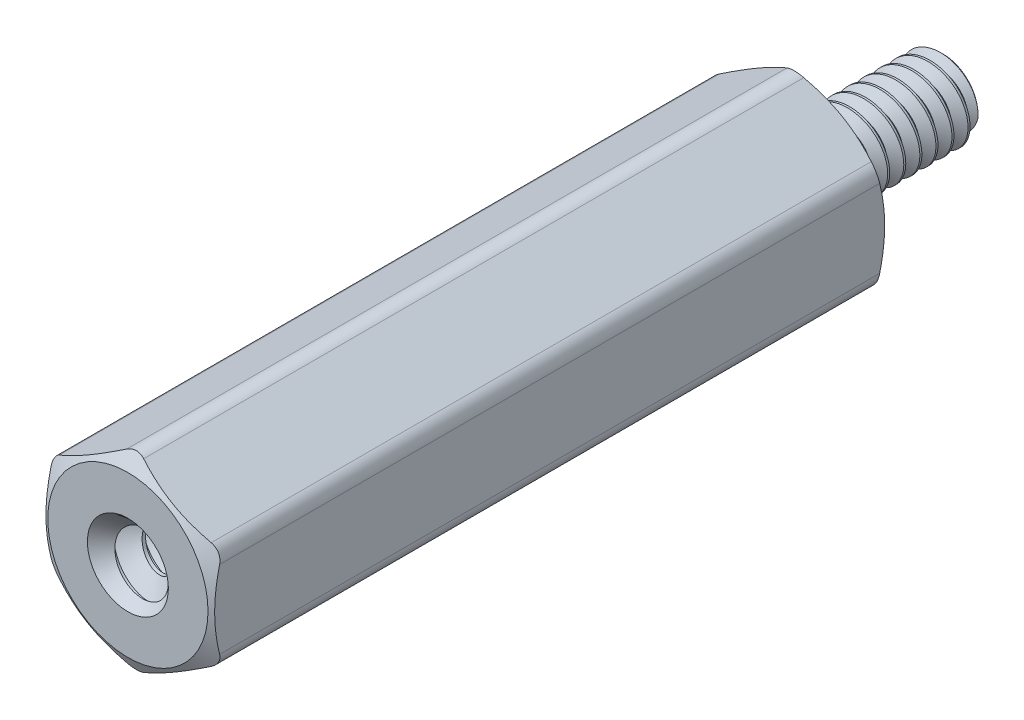
from build123d import *

# Parameters (mm, degrees)
SKETCH4_R           = 1.736725
BOSS_EXTRUDE1_DEPTH = 19.05
SKETCH5_OUTSIDE_W   = 95.784
SKETCH5_OUTSIDE_H   = 96.522
SKETCH5_OUTSIDE_R   = 2.2621875
CUT_EXTRUDE1_DEPTH  = 24.304370231
CUT_EXTRUDE1_DRAFT  = -60
SKETCH6_OUTSIDE_W   = 82.238
SKETCH6_OUTSIDE_H   = 82.976
SKETCH6_OUTSIDE_R   = 2.2621875
CUT_EXTRUDE2_DEPTH  = 20.39415686
CUT_EXTRUDE2_DRAFT  = -60
FILLET1_R           = 0.47625
CUT_SWEEP1_PITCH    = 0.453571429
SKETCH9_R           = 1.205592857
BOSS_EXTRUDE2_DEPTH = 4.7752
SKETCH10_W          = 4.7752
SKETCH10_H          = 1.0922
CUT_SWEEP2_PITCH    = 0.79375


with BuildPart() as part:
    # Sketch3 → Revolve1 (revolve)
    with BuildSketch(Plane(origin=(0, 0, 0), x_dir=(0, 0, -1), z_dir=(1, 0, 0))):
        with BuildLine():
            Line((-14.2748, 0.978807143), (-14.2748, 0))
            Line((-14.2748, 0), (3.96875, 0))
            Line((3.96875, 0), (3.96875, 0.978807143))
            Line((3.96875, 0.978807143), (3.855357143, 1.0922))
            Line((3.855357143, 1.0922), (0.646339286, 1.0922))
            Line((0.646339286, 1.0922), (0.47625, 0.797596715))
            Line((0.47625, 0.797596715), (0.113392857, 0.797596715))
            ThreePointArc((0.113392857, 0.797596715), (0.033211999, 0.830808714), (0, 0.910989572))
            Line((0, 0.910989572), (0, 2.38125))
            Line((0, 2.38125), (-19.05, 2.38125))
            Line((-19.05, 2.38125), (-19.05, 1.205592857))
            Line((-19.05, 1.205592857), (-18.936607143, 1.0922))
            Line((-18.936607143, 1.0922), (-14.388192857, 1.0922))
            Line((-14.388192857, 1.0922), (-14.2748, 0.978807143))
        make_face()
    revolve(axis=Axis((0, 0, -3.96875), (0, 0, 1)))

    # Sketch4 → Boss-Extrude1 (add)
    with BuildSketch(Plane.XY.offset(19.05)):
        Polygon((-2.38125, 1.374815329), (-2.38125, -1.374815329), (0, -2.749630657), (2.38125, -1.374815329), (2.38125, 1.374815329), (0, 2.749630657), align=None)
        Circle(SKETCH4_R, mode=Mode.SUBTRACT)
    extrude(amount=-BOSS_EXTRUDE1_DEPTH)


with BuildPart() as cut_extrude1_tool:
    # Sketch5 outside → Cut-Extrude1 (with draft: the straight prism first)
    with BuildSketch(Plane.XY.offset(19.05)):
        Rectangle(SKETCH5_OUTSIDE_W, SKETCH5_OUTSIDE_H)
        Circle(SKETCH5_OUTSIDE_R, mode=Mode.SUBTRACT)
    extrude(amount=-CUT_EXTRUDE1_DEPTH)
    # Cut-Extrude1: the draft: its side faces are tilted about the plane it starts from
    cut_extrude1_sides = [cut_extrude1_tool.faces().sort_by_distance(p)[0] for p in [
        (0, -48.261, 6.897814884),
        (47.892, 0, 6.897814884),
        (0, 48.261, 6.897814884),
        (-47.892, 0, 6.897814884),
        (-2.2621875, 0, 6.897814884),
    ]]
    draft(cut_extrude1_sides, Plane.XY.offset(19.05), CUT_EXTRUDE1_DRAFT)


with BuildPart() as part_1:
    add(part.part)

    # Cut-Extrude1: cut by cut_extrude1_tool
    add(cut_extrude1_tool.part, mode=Mode.SUBTRACT)


with BuildPart() as cut_extrude2_tool:
    # Sketch6 outside → Cut-Extrude2 (with draft: the straight prism first)
    with BuildSketch(Plane(origin=(0, 0, 0), x_dir=(-1, 0, 0), z_dir=(0, 0, -1))):
        Rectangle(SKETCH6_OUTSIDE_W, SKETCH6_OUTSIDE_H)
        Circle(SKETCH6_OUTSIDE_R, mode=Mode.SUBTRACT)
    extrude(amount=-CUT_EXTRUDE2_DEPTH)
    # Cut-Extrude2: the draft: its side faces are tilted about the plane it starts from
    cut_extrude2_sides = [cut_extrude2_tool.faces().sort_by_distance(p)[0] for p in [
        (0, -41.488, 10.19707843),
        (-41.119, 0, 10.19707843),
        (0, 41.488, 10.19707843),
        (41.119, 0, 10.19707843),
        (2.2621875, 0, 10.19707843),
    ]]
    draft(cut_extrude2_sides, Plane(origin=(0, 0, 0), x_dir=(-1, 0, 0), z_dir=(0, 0, -1)), CUT_EXTRUDE2_DRAFT)


with BuildPart() as part_2:
    add(part_1.part)

    # Cut-Extrude2: cut by cut_extrude2_tool
    add(cut_extrude2_tool.part, mode=Mode.SUBTRACT)

    # Fillet1
    fillet1_edges = [part_2.edges().sort_by_distance(p)[0] for p in [
        (0, 2.749630657, 9.525),
        (-2.38125, -1.374815329, 9.525),
        (0, -2.749630657, 9.525),
        (2.38125, -1.374815329, 9.525),
        (2.38125, 1.374815329, 9.525),
        (-2.38125, 1.374815329, 9.525),
    ]]
    fillet(fillet1_edges, radius=FILLET1_R)

    # Cut-Sweep1: the profile of Sketch7 profile screwed along a right-hand helix of 8.4875 turns, 6 arcs to a turn; built about Z, then put on its axis
    cut_sweep1_z = Axis((0, 0, 0), (0, 0, 1))
    cut_sweep1_corners = [(0.797296715, 0, -0.170262491), (0.797296715, 0, -0.226612509), (1.116750274, 0, -0.411049107), (1.116750274, 0, 0.014174107)]
    with BuildLine(mode=Mode.PRIVATE) as cut_sweep1_profile:
        Line(cut_sweep1_corners[0], cut_sweep1_corners[1])
        Line(cut_sweep1_corners[1], cut_sweep1_corners[2])
        Line(cut_sweep1_corners[2], cut_sweep1_corners[3])
        Line(cut_sweep1_corners[3], cut_sweep1_corners[0])
    cut_sweep1_cap = Face(cut_sweep1_profile.wire())
    cut_sweep1_turn_angles = [0, 30, 60, 90, 120, 150, 180, 210, 240, 270, 300, 330, 360]
    cut_sweep1_turn_weights = [1, 0.8660254037844387, 1, 0.8660254037844387, 1, 0.8660254037844387, 1, 0.8660254037844387, 1, 0.8660254037844387, 1, 0.8660254037844387, 1]
    cut_sweep1_turn_rails = [Edge.make_bspline([Vector(p[0], p[1], 0).rotate(cut_sweep1_z, cut_sweep1_turn_angles[k]) / cut_sweep1_turn_weights[k] + Vector(0, 0, p[2] + CUT_SWEEP1_PITCH * cut_sweep1_turn_angles[k] / 360) for k in range(13)], [0, 0, 0, 1, 1, 2, 2, 3, 3, 4, 4, 5, 5, 6, 6, 6], 2, cut_sweep1_turn_weights) for p in cut_sweep1_corners]
    cut_sweep1_turn_sides = [Face.make_surface_from_curves(cut_sweep1_turn_rails[p[0]], cut_sweep1_turn_rails[p[1]]) for p in [(0, 1), (1, 2), (2, 3), (3, 0)]]
    cut_sweep1_last_angles = [2880, 2910, 2940, 2970, 3000, 3027.75, 3055.5]
    cut_sweep1_last_weights = [1, 0.8660254037844387, 1, 0.8660254037844387, 1, 0.8849876374631195, 1]
    cut_sweep1_last_rails = [Edge.make_bspline([Vector(p[0], p[1], 0).rotate(cut_sweep1_z, cut_sweep1_last_angles[k]) / cut_sweep1_last_weights[k] + Vector(0, 0, p[2] + CUT_SWEEP1_PITCH * cut_sweep1_last_angles[k] / 360) for k in range(7)], [0, 0, 0, 1, 1, 2, 2, 3, 3, 3], 2, cut_sweep1_last_weights) for p in cut_sweep1_corners]
    cut_sweep1_last_sides = [Face.make_surface_from_curves(cut_sweep1_last_rails[p[0]], cut_sweep1_last_rails[p[1]]) for p in [(0, 1), (1, 2), (2, 3), (3, 0)]]
    cut_sweep1 = Plane(origin=(0, 0, -3.96875), x_dir=(0, 1, 0), z_dir=(0, 0, 1)) * Solid(Shell([*[p.moved(Location((0, 0, CUT_SWEEP1_PITCH * i))) for i in range(8) for p in cut_sweep1_turn_sides], *cut_sweep1_last_sides, cut_sweep1_cap, cut_sweep1_cap.rotate(cut_sweep1_z, 3055.5).moved(Location((0, 0, CUT_SWEEP1_PITCH * 3055.5 / 360)))]))
    add(cut_sweep1, mode=Mode.SUBTRACT)

    # Sketch9 → Boss-Extrude2 (add)
    with BuildSketch(Plane.XY.offset(14.2748)):
        Circle(SKETCH9_R)
    extrude(amount=BOSS_EXTRUDE2_DEPTH)


with BuildPart() as body_2:
    # Sketch10 → Revolve2 (revolve)
    with BuildSketch(Plane(origin=(0, 0, 0), x_dir=(0, 0, -1), z_dir=(1, 0, 0))):
        with Locations((-16.6624, 0.5461)):
            Rectangle(SKETCH10_W, SKETCH10_H)
    revolve(axis=Axis((0, 0, -3.96875), (0, 0, 1)))

    # Cut-Sweep2: the profile of Sketch12 screwed along a right-hand helix of 7.016 turns, 8 arcs to a turn; built about Z, then put on its axis
    cut_sweep2_z = Axis((0, 0, 0), (0, 0, 1))
    cut_sweep2_corners = [(0.576644252, 0, -0.396875), (0.576644252, 0, -0.29765625), (1.135162979, 0, 0.024804688), (1.135162979, 0, -0.719335937)]
    with BuildLine(mode=Mode.PRIVATE) as cut_sweep2_profile:
        Line(cut_sweep2_corners[0], cut_sweep2_corners[1])
        Line(cut_sweep2_corners[1], cut_sweep2_corners[2])
        Line(cut_sweep2_corners[2], cut_sweep2_corners[3])
        Line(cut_sweep2_corners[3], cut_sweep2_corners[0])
    cut_sweep2_cap = Face(cut_sweep2_profile.wire())
    cut_sweep2_turn_angles = [0, 22.5, 45, 67.5, 90, 112.5, 135, 157.5, 180, 202.5, 225, 247.5, 270, 292.5, 315, 337.5, 360]
    cut_sweep2_turn_weights = [1, 0.9238795325112867, 1, 0.9238795325112867, 1, 0.9238795325112867, 1, 0.9238795325112867, 1, 0.9238795325112867, 1, 0.9238795325112867, 1, 0.9238795325112867, 1, 0.9238795325112867, 1]
    cut_sweep2_turn_rails = [Edge.make_bspline([Vector(p[0], p[1], 0).rotate(cut_sweep2_z, cut_sweep2_turn_angles[k]) / cut_sweep2_turn_weights[k] + Vector(0, 0, p[2] + CUT_SWEEP2_PITCH * cut_sweep2_turn_angles[k] / 360) for k in range(17)], [0, 0, 0, 1, 1, 2, 2, 3, 3, 4, 4, 5, 5, 6, 6, 7, 7, 8, 8, 8], 2, cut_sweep2_turn_weights) for p in cut_sweep2_corners]
    cut_sweep2_turn_sides = [Face.make_surface_from_curves(cut_sweep2_turn_rails[p[0]], cut_sweep2_turn_rails[p[1]]) for p in [(0, 1), (1, 2), (2, 3), (3, 0)]]
    cut_sweep2_last_angles = [2520, 2522.88, 2525.76]
    cut_sweep2_last_weights = [1, 0.9987369566060144, 1]
    cut_sweep2_last_rails = [Edge.make_bspline([Vector(p[0], p[1], 0).rotate(cut_sweep2_z, cut_sweep2_last_angles[k]) / cut_sweep2_last_weights[k] + Vector(0, 0, p[2] + CUT_SWEEP2_PITCH * cut_sweep2_last_angles[k] / 360) for k in range(3)], [0, 0, 0, 1, 1, 1], 2, cut_sweep2_last_weights) for p in cut_sweep2_corners]
    cut_sweep2_last_sides = [Face.make_surface_from_curves(cut_sweep2_last_rails[p[0]], cut_sweep2_last_rails[p[1]]) for p in [(0, 1), (1, 2), (2, 3), (3, 0)]]
    cut_sweep2 = Plane(origin=(0, 0, 19.05), x_dir=(0, 1, 0), z_dir=(0, 0, -1)) * Solid(Shell([*[p.moved(Location((0, 0, CUT_SWEEP2_PITCH * i))) for i in range(7) for p in cut_sweep2_turn_sides], *cut_sweep2_last_sides, cut_sweep2_cap, cut_sweep2_cap.rotate(cut_sweep2_z, 2525.76).moved(Location((0, 0, CUT_SWEEP2_PITCH * 2525.76 / 360)))]))
    add(cut_sweep2, mode=Mode.SUBTRACT)


with BuildPart() as part_3:
    add(part_2.part)

    # Combine1: cut body 2
    add(body_2.part, mode=Mode.SUBTRACT)

    # Cut-Extrude3 cone 1 section (through the dimple's axis) → Cut-Extrude3 (revolve, cut)
    with BuildSketch(Plane(origin=(0, 0, 19.05), x_dir=(0, -1, 0), z_dir=(1, 0, 0))):
        Polygon((0, 0), (1.143, 0), (0, 1.143), align=None)
    revolve(axis=Axis((0, 0, 19.05), (0, 0, -1)), mode=Mode.SUBTRACT)


solid = part_3.part
